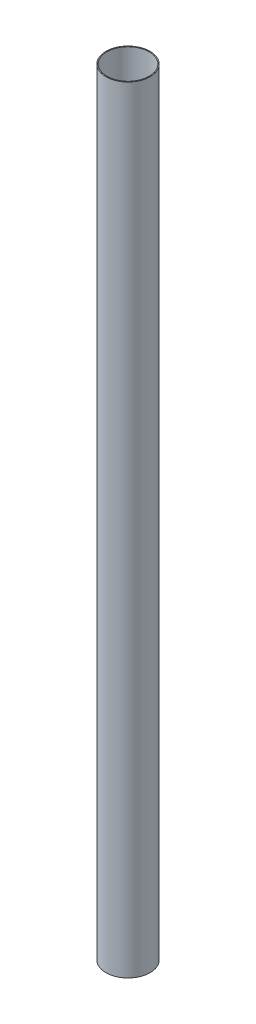
from build123d import *

# Parameters (mm, degrees)
SZKIC1_R                    = 25.3
SZKIC1_R_2                  = 24.3
DODANIE_WYCI_GNI_CIE1_DEPTH = 890


with BuildPart() as part:
    # Szkic1 → Dodanie-wyciągnięcie1 (new body)
    with BuildSketch(Plane(origin=(0, 0, 0), x_dir=(1, 0, 0), z_dir=(0, 1, 0))):
        Circle(SZKIC1_R)
        Circle(SZKIC1_R_2, mode=Mode.SUBTRACT)
    extrude(amount=DODANIE_WYCI_GNI_CIE1_DEPTH)


solid = part.part
